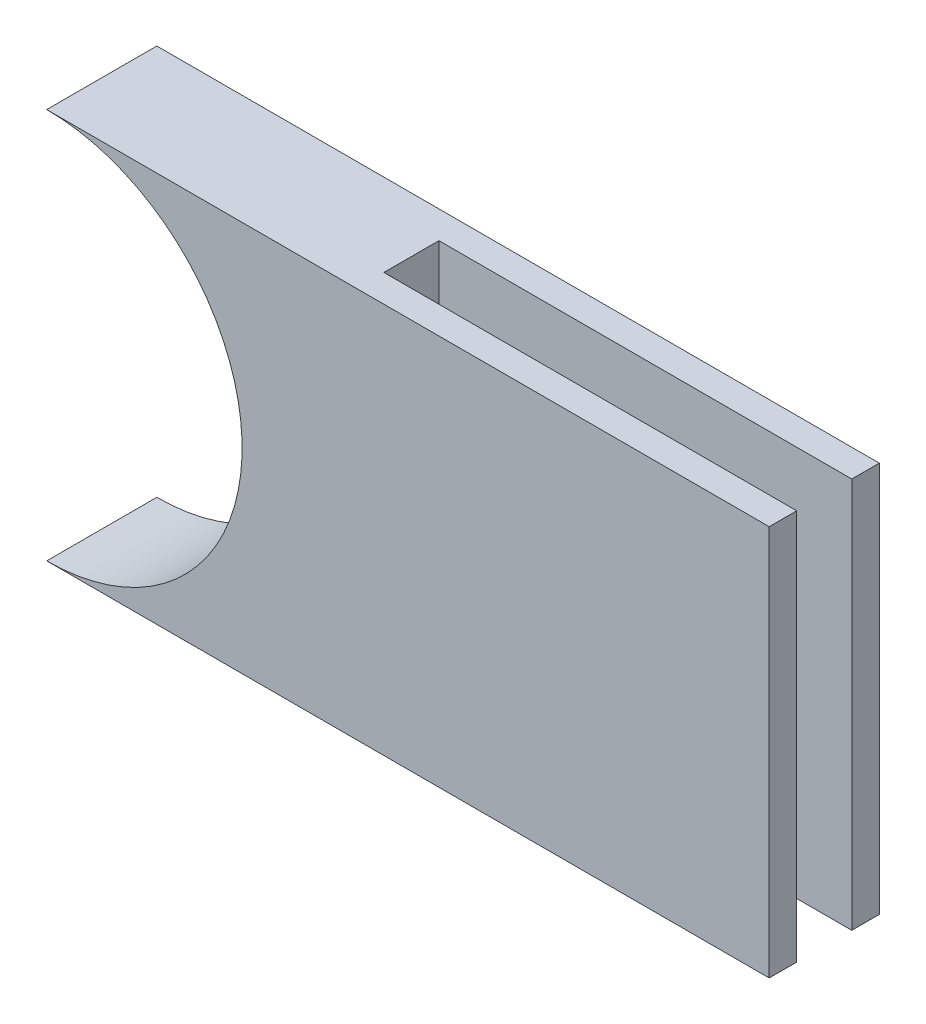
from build123d import *

# Parameters (mm, degrees)
SKETCH1_R               = 19.939
CIRCLE_EXTRUDE_DEPTH    = 7.62
SKETCH3_W               = 7.62
SKETCH3_H               = 39.878
RECTANGLE_EXTRUDE_DEPTH = 68.58
SKETCH2_R               = 18.034
CRICLE_CUT_DEPTH        = 72.825096735
SKETCH4_OUTSIDE_W       = 109.997
SKETCH4_OUTSIDE_H       = 61.356
SKETCH4_OUTSIDE_W_2     = 66.675
SKETCH4_OUTSIDE_H_2     = 36.068
FRAME_CUT_DEPTH         = 72.825096735
EXTENSION_DEPTH         = 2.54
SKETCH13_W              = 5.08
SKETCH13_H              = 36.068
CUT_EXTRUDE1_DEPTH      = 38.1
SKETCH14_R              = 1.905
BOSS_EXTRUDE3_DEPTH     = 2.54


with BuildPart() as part:
    # Sketch1 → circle extrude (new body)
    with BuildSketch(Plane.XY):
        Circle(SKETCH1_R)
    extrude(amount=CIRCLE_EXTRUDE_DEPTH)

    # Sketch3 → rectangle extrude (add)
    with BuildSketch(Plane(origin=(0, 0, 0), x_dir=(0, 0, -1), z_dir=(1, 0, 0))):
        with Locations((-3.81, 0)):
            Rectangle(SKETCH3_W, SKETCH3_H)
    extrude(amount=RECTANGLE_EXTRUDE_DEPTH)

    # Sketch2 → cricle cut (cut, through all)
    with BuildSketch(Plane.XY.offset(7.62)):
        Circle(SKETCH2_R)
    extrude(amount=-CRICLE_CUT_DEPTH, mode=Mode.SUBTRACT)

    # Sketch4 outside → frame cut (cut, through all)
    with BuildSketch(Plane.XY.offset(7.62)):
        with Locations((24.3205, 0)):
            Rectangle(SKETCH4_OUTSIDE_W, SKETCH4_OUTSIDE_H)
        with Locations((33.3375, 0)):
            Rectangle(SKETCH4_OUTSIDE_W_2, SKETCH4_OUTSIDE_H_2, mode=Mode.SUBTRACT)
    extrude(amount=-FRAME_CUT_DEPTH, mode=Mode.SUBTRACT)

    # Sketch10 → extension (add)
    with BuildSketch(Plane(origin=(0, 0, 0), x_dir=(-1, 0, 0), z_dir=(0, 0, -1))):
        with BuildLine():
            Line((0, 18.034), (-66.675, 18.034))
            Line((-66.675, 18.034), (-66.675, -18.034))
            Line((-66.675, -18.034), (0, -18.034))
            ThreePointArc((0, -18.034), (-18.034, 0), (0, 18.034))
        make_face()
    extrude(amount=EXTENSION_DEPTH)

    # Sketch13 → Cut-Extrude1 (cut)
    with BuildSketch(Plane(origin=(66.675, 0, 0), x_dir=(0, 0, -1), z_dir=(1, 0, 0))):
        with Locations((-2.54, 0)):
            Rectangle(SKETCH13_W, SKETCH13_H)
    extrude(amount=-CUT_EXTRUDE1_DEPTH, mode=Mode.SUBTRACT)

    # Sketch14 → Boss-Extrude3 (add)
    with BuildSketch(Plane(origin=(28.575, 0, 0), x_dir=(0, 0, -1), z_dir=(1, 0, 0))):
        with Locations((-2.54, 0)):
            Circle(SKETCH14_R)
    extrude(amount=BOSS_EXTRUDE3_DEPTH)


solid = part.part
